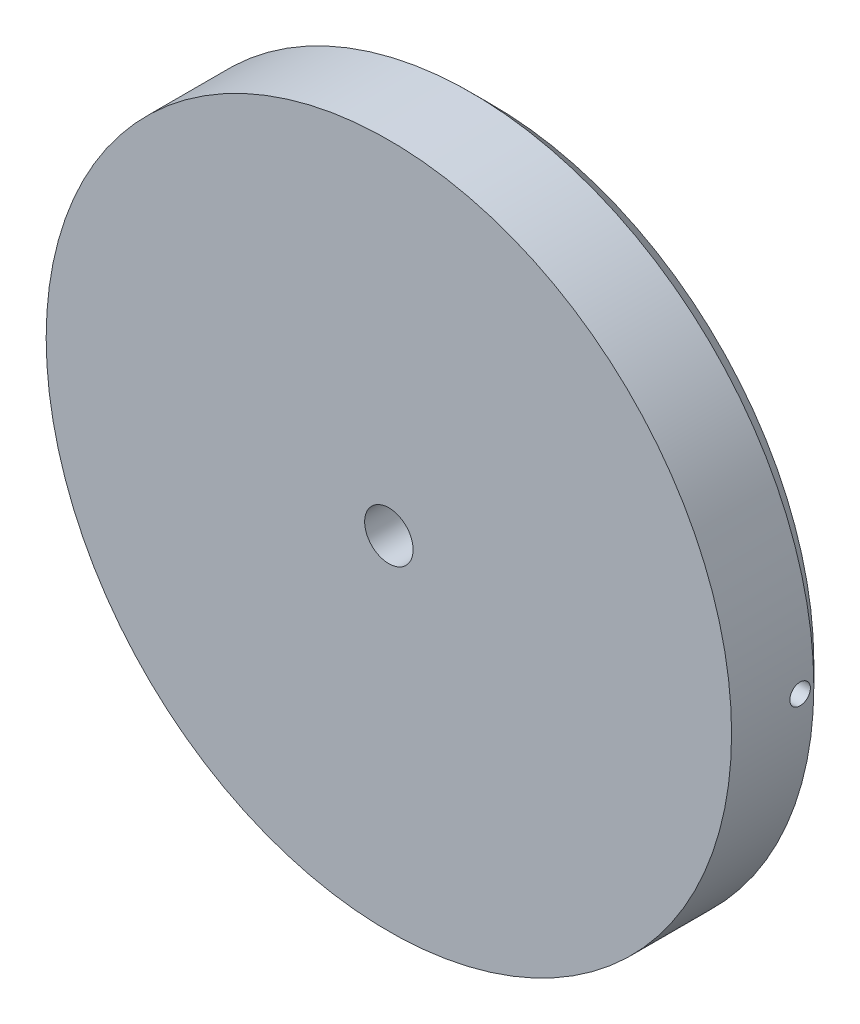
from build123d import *

# Parameters (mm, degrees)
BOSS_EXTRUDE1_DEPTH             = 10
BOSS_EXTRUDE1_DEPTH_BACK        = 5
SKETCH1_R                       = 50
SKETCH1_R_2                     = 3.535
SKETCH2_R                       = 1.5
CUT_EXTRUDE1_DEPTH              = 72.414284285
SKETCH3_R                       = 1.5
CUT_EXTRUDE2_DEPTH              = 72.414284444
CHAMFER1_SIZE                   = 3
BOSS_EXTRUDE2_REACH             = 73.414
SKETCH4_R                       = 44
SKETCH4_R_2                     = 3.535
BOSS_EXTRUDE2_DIRECTION_2_REACH = 73.414


with BuildPart() as part:
    # Sketch1 → Boss-Extrude1 (new, two sides: drawn at the far end of the back side and taken through both)
    with BuildSketch(Plane.XY.offset(-BOSS_EXTRUDE1_DEPTH_BACK)):
        Circle(SKETCH1_R)
        Circle(SKETCH1_R_2, mode=Mode.SUBTRACT)
    extrude(amount=BOSS_EXTRUDE1_DEPTH + BOSS_EXTRUDE1_DEPTH_BACK)

    # Sketch2 → Cut-Extrude1 (cut, through all)
    with BuildSketch(Plane(origin=(0, 0, 0), x_dir=(1, 0, 0), z_dir=(0, 1, 0))):
        Circle(SKETCH2_R)
    extrude(amount=-CUT_EXTRUDE1_DEPTH, mode=Mode.SUBTRACT)

    # Sketch3 → Cut-Extrude2 (cut, through all)
    with BuildSketch(Plane(origin=(0, 0, 0), x_dir=(0, 0, -1), z_dir=(1, 0, 0))):
        Circle(SKETCH3_R)
    extrude(amount=CUT_EXTRUDE2_DEPTH, mode=Mode.SUBTRACT)

    # Chamfer1
    chamfer1_edges = [part.edges().sort_by_distance(p)[0] for p in [
        (-50, 0, -5),
    ]]
    chamfer(chamfer1_edges, length=CHAMFER1_SIZE)

    # Boss-Extrude2: up to this face of the body (flat: up to its plane)
    boss_extrude2_end = Plane(part.part.faces().sort_by_distance((-48.585786438, 0, 10))[0])
    # Sketch4 → Boss-Extrude2 (add, up to the picked face)
    with BuildSketch(Plane.XY, mode=Mode.PRIVATE) as boss_extrude2_sk1:
        Circle(SKETCH4_R)
        Circle(SKETCH4_R_2, mode=Mode.SUBTRACT)
    boss_extrude2_tool1 = split(extrude(boss_extrude2_sk1.sketch, amount=BOSS_EXTRUDE2_REACH, mode=Mode.PRIVATE), bisect_by=boss_extrude2_end, keep=Keep.BOTH, mode=Mode.PRIVATE)
    add(boss_extrude2_tool1.solids().sort_by(Axis((-42.755492, 0, 0), (0, 0, 1)))[0])

    # Boss-Extrude2 direction 2: up to this face of the body (flat: up to its plane)
    boss_extrude2_direction_2_end = Plane(part.part.faces().sort_by_distance((-45.670639251, 0, -5))[0])
    # Sketch4 → Boss-Extrude2 direction 2 (add, up to the picked face)
    with BuildSketch(Plane.XY, mode=Mode.PRIVATE) as boss_extrude2_direction_2_sk1:
        Circle(SKETCH4_R)
        Circle(SKETCH4_R_2, mode=Mode.SUBTRACT)
    boss_extrude2_direction_2_tool1 = split(extrude(boss_extrude2_direction_2_sk1.sketch, amount=-BOSS_EXTRUDE2_DIRECTION_2_REACH, mode=Mode.PRIVATE), bisect_by=boss_extrude2_direction_2_end, keep=Keep.BOTH, mode=Mode.PRIVATE)
    add(boss_extrude2_direction_2_tool1.solids().sort_by(Axis((-42.755492, 0, 0), (0, 0, -1)))[0])


solid = part.part
